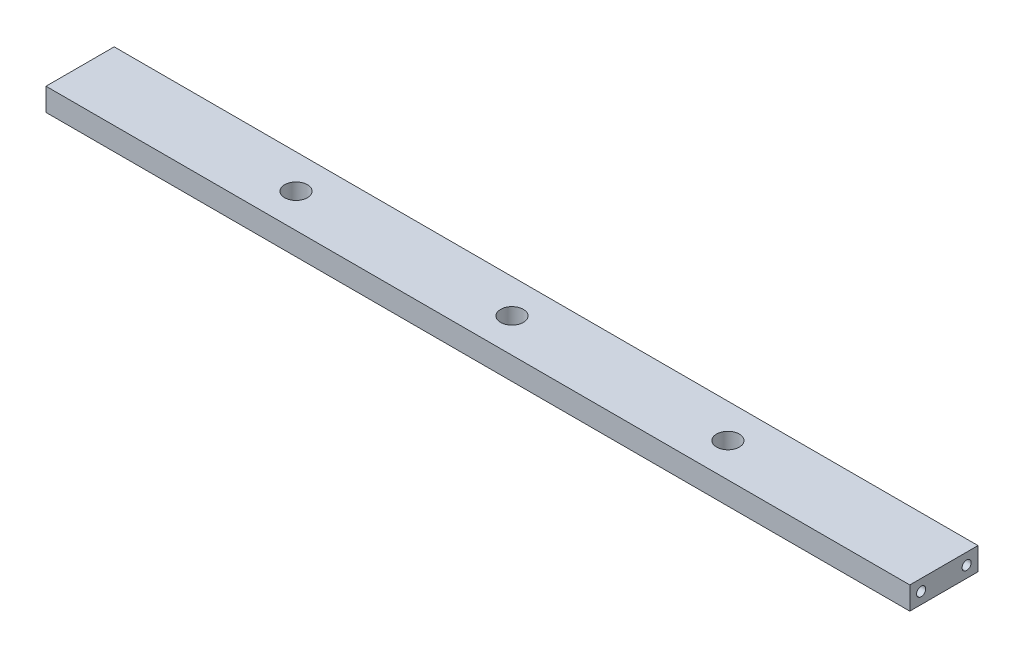
from build123d import *

# Parameters (mm, degrees)
SKETCH1_W                        = 38.1
SKETCH1_H                        = 12.7
BOSS_EXTRUDE1_DEPTH              = 241.3
F_1_4_20_TAPPED_HOLE1_AT_2_COUNT = 2
F_1_4_20_TAPPED_HOLE1_AT_2_PITCH = 25.4
SKETCH2_R                        = 6.35
CUT_EXTRUDE1_DEPTH               = 243.383750487
CUT_EXTRUDE2_DEPTH               = 9.525


with BuildPart() as part:
    # Sketch1 → Boss-Extrude1 (new, symmetric)
    with BuildSketch(Plane(origin=(0, 0, 0), x_dir=(0, 0, -1), z_dir=(1, 0, 0))):
        Rectangle(SKETCH1_W, SKETCH1_H)
    extrude(amount=BOSS_EXTRUDE1_DEPTH, both=True)

    # Sketch3 → 1/4-20 Tapped Hole1 (revolve, cut)
    with BuildSketch(Plane(origin=(241.3, 0, 12.7), x_dir=(0, 0, -1), z_dir=(0, 1, 0))):
        Polygon((0, 0), (0, 20.583816902), (2.5527, 19.05), (2.5527, 0), align=None)
    f_1_4_20_tapped_hole1 = revolve(axis=Axis((247.65, 0, 12.7), (-1, 0, 0)), mode=Mode.SUBTRACT)

    # 1/4-20 Tapped Hole1 at 2: 1/4-20 Tapped Hole1 ×2
    with Locations(*[(0, 0, -i * F_1_4_20_TAPPED_HOLE1_AT_2_PITCH) for i in range(1, F_1_4_20_TAPPED_HOLE1_AT_2_COUNT)]):
        add(f_1_4_20_tapped_hole1, mode=Mode.SUBTRACT)

    # Sketch2 → Cut-Extrude1 (cut, through all)
    with BuildSketch(Plane(origin=(0, 6.35, 0), x_dir=(1, 0, 0), z_dir=(0, 1, 0))):
        Circle(SKETCH2_R)
        with Locations((120.65, 0)):
            Circle(SKETCH2_R)
    cut_extrude1 = extrude(amount=-CUT_EXTRUDE1_DEPTH, mode=Mode.SUBTRACT)

    # Sketch4 → Cut-Extrude2 (cut)
    with BuildSketch(Plane.XZ.offset(6.35)):
        with BuildLine():
            Line((12.7, 12.7), (107.95, 12.7))
            ThreePointArc((107.95, 12.7), (110.789806331, 10.944903166), (110.49, 7.62))
            ThreePointArc((110.49, 7.62), (107.95, 0), (110.49, -7.62))
            ThreePointArc((110.49, -7.62), (110.789806331, -10.944903166), (107.95, -12.7))
            Line((107.95, -12.7), (12.7, -12.7))
            ThreePointArc((12.7, -12.7), (9.860193669, -10.944903166), (10.16, -7.62))
            ThreePointArc((10.16, -7.62), (12.7, 0), (10.16, 7.62))
            ThreePointArc((10.16, 7.62), (9.860193669, 10.944903166), (12.7, 12.7))
        make_face()
        with BuildLine():
            Line((133.35, 12.7), (212.725, 12.7))
            ThreePointArc((212.725, 12.7), (214.97006403, 11.77006403), (215.9, 9.525))
            Line((215.9, 9.525), (215.9, -9.525))
            ThreePointArc((215.9, -9.525), (214.97006403, -11.77006403), (212.725, -12.7))
            Line((212.725, -12.7), (133.35, -12.7))
            ThreePointArc((133.35, -12.7), (130.510193669, -10.944903166), (130.81, -7.62))
            ThreePointArc((130.81, -7.62), (133.35, 0), (130.81, 7.62))
            ThreePointArc((130.81, 7.62), (130.510193669, 10.944903166), (133.35, 12.7))
        make_face()
    cut_extrude2 = extrude(amount=-CUT_EXTRUDE2_DEPTH, mode=Mode.SUBTRACT)

    # Mirror2: 1/4-20 Tapped Hole1, Cut-Extrude1, Cut-Extrude2 across plane
    add(f_1_4_20_tapped_hole1.mirror(Plane(origin=(0, 0, 0), x_dir=(0, 0, 1), z_dir=(1, 0, 0))), mode=Mode.SUBTRACT)
    add(cut_extrude1.mirror(Plane(origin=(0, 0, 0), x_dir=(0, 0, 1), z_dir=(1, 0, 0))), mode=Mode.SUBTRACT)
    add(cut_extrude2.mirror(Plane(origin=(0, 0, 0), x_dir=(0, 0, 1), z_dir=(1, 0, 0))), mode=Mode.SUBTRACT)

    # Mirror2 copy 1 sketch → Mirror2 copy 1 (revolve, cut)
    with BuildSketch(Plane(origin=(-241.3, 0, -12.7), x_dir=(0, 0, -1), z_dir=(0, 1, 0))):
        Polygon((0, 0), (0, -20.583816902), (2.5527, -19.05), (2.5527, 0), align=None)
    revolve(axis=Axis((-247.65, 0, -12.7), (-1, 0, 0)), mode=Mode.SUBTRACT)


solid = part.part
